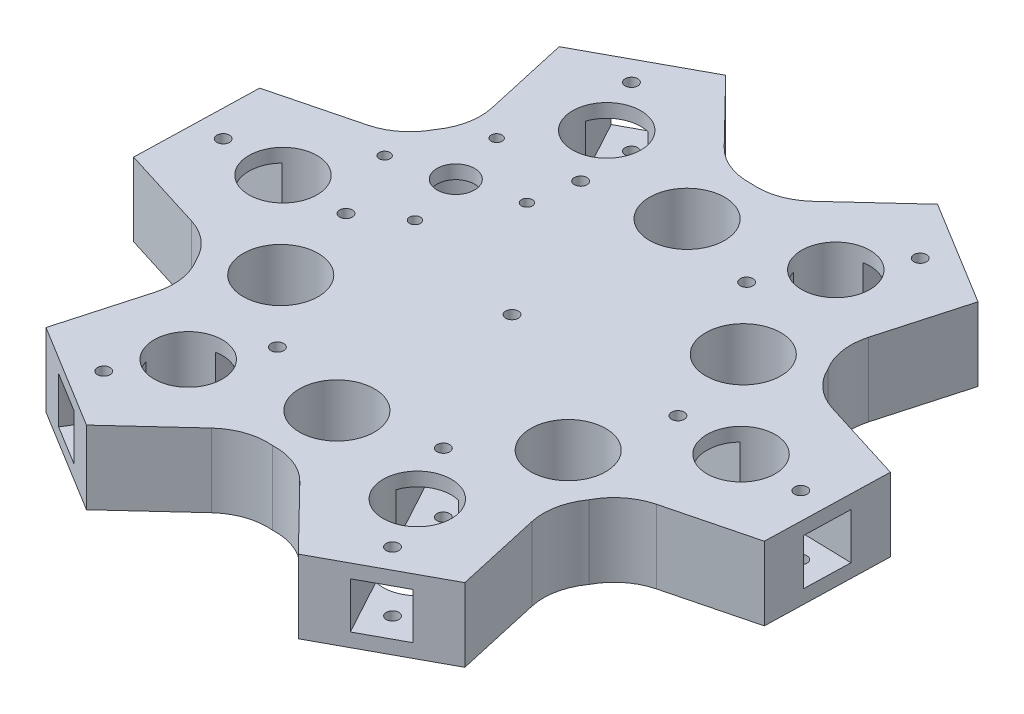
from build123d import *

# Parameters (mm, degrees)
CROQUIS2_R              = 1.85
CROQUIS2_R_2            = 10
CROQUIS2_R_3            = 11
SALIENTE_EXTRUIR1_DEPTH = 21.5
CROQUIS3_W              = 13.5
CROQUIS3_H              = 13.5
CORTAR_EXTRUIR1_DEPTH   = 227.063412752
MATRIZC1_COUNT          = 6
SALIENTE_EXTRUIR2_START = -4
CROQUIS4_R              = 11
CROQUIS4_R_2            = 5.5
SALIENTE_EXTRUIR2_DEPTH = 4
CORTAR_EXTRUIR2_START   = -10
CROQUIS5_R              = 1.6
CROQUIS5_R_2            = 5.5
CORTAR_EXTRUIR2_DEPTH   = 10


with BuildPart() as part:
    # Croquis2 → Saliente-Extruir1 (new body)
    with BuildSketch(Plane(origin=(0, 0, 0), x_dir=(1, 0, 0), z_dir=(0, 1, 0))):
        with BuildLine():
            Line((34.338474425, 90.387328615), (65.023396068, 71.560868943))
            Line((65.023396068, 71.560868943), (57.99870039, 46.557847845))
            ThreePointArc((57.99870039, 46.557847845), (57.540985683, 39.344606317), (60.071411753, 32.574281363))
            ThreePointArc((60.071411753, 32.574281363), (64.365061572, 26.760080874), (70.66006642, 23.20856429))
            Line((70.66006642, 23.20856429), (95.446959973, 15.455673128))
            Line((95.446959973, 15.455673128), (94.485228455, -20.531478364))
            Line((94.485228455, -20.531478364), (69.319629174, -26.949424002))
            ThreePointArc((69.319629174, -26.949424002), (62.843921414, -30.159652201), (58.245861047, -35.736227938))
            ThreePointArc((58.245861047, -35.736227938), (55.357440631, -42.361738001), (55.42923947, -49.589130408))
            Line((55.42923947, -49.589130408), (61.108485548, -74.931655487))
            Line((61.108485548, -74.931655487), (29.461832387, -92.092347306))
            Line((29.461832387, -92.092347306), (11.320928784, -73.507271847))
            ThreePointArc((11.320928784, -73.507271847), (5.302935731, -69.504258519), (-1.825550706, -68.310509301))
            ThreePointArc((-1.825550706, -68.310509301), (-9.007620942, -69.121818875), (-15.23082695, -72.797694698))
            Line((-15.23082695, -72.797694698), (-34.338474425, -90.387328615))
            Line((-34.338474425, -90.387328615), (-65.023396068, -71.560868943))
            Line((-65.023396068, -71.560868943), (-57.99870039, -46.557847845))
            ThreePointArc((-57.99870039, -46.557847845), (-57.540985683, -39.344606317), (-60.071411753, -32.574281363))
            ThreePointArc((-60.071411753, -32.574281363), (-64.365061572, -26.760080874), (-70.66006642, -23.20856429))
            Line((-70.66006642, -23.20856429), (-95.446959973, -15.455673128))
            Line((-95.446959973, -15.455673128), (-94.485228455, 20.531478364))
            Line((-94.485228455, 20.531478364), (-69.319629174, 26.949424002))
            ThreePointArc((-69.319629174, 26.949424002), (-62.843921414, 30.159652201), (-58.245861047, 35.736227938))
            ThreePointArc((-58.245861047, 35.736227938), (-55.357440631, 42.361738001), (-55.42923947, 49.589130408))
            Line((-55.42923947, 49.589130408), (-61.108485548, 74.931655487))
            Line((-61.108485548, 74.931655487), (-29.461832387, 92.092347306))
            Line((-29.461832387, 92.092347306), (-11.320928784, 73.507271847))
            ThreePointArc((-11.320928784, 73.507271847), (-5.302935731, 69.504258519), (1.825550706, 68.310509301))
            ThreePointArc((1.825550706, 68.310509301), (9.007620942, 69.121818875), (15.23082695, 72.797694698))
            Line((15.23082695, 72.797694698), (34.338474425, 90.387328615))
        make_face()
        with Locations((45.497277541, 74.155227303)):
            Circle(CROQUIS2_R, mode=Mode.SUBTRACT)
        with Locations((26.147860656, 42.617946726)):
            Circle(CROQUIS2_R, mode=Mode.SUBTRACT)
        with Locations((36.084047705, 58.812766481)):
            Circle(CROQUIS2_R_2, mode=Mode.SUBTRACT)
        Circle(CROQUIS2_R, mode=Mode.SUBTRACT)
        with Locations((43.953684946, 23.834294194)):
            Circle(CROQUIS2_R_3, mode=Mode.SUBTRACT)
        with Locations((68.975373692, -1.843318743)):
            Circle(CROQUIS2_R_2, mode=Mode.SUBTRACT)
        with Locations((86.968949438, -2.324184502)):
            Circle(CROQUIS2_R, mode=Mode.SUBTRACT)
        with Locations((49.98215485, -1.33573822)):
            Circle(CROQUIS2_R, mode=Mode.SUBTRACT)
        with Locations((42.617946726, -26.147860656)):
            Circle(CROQUIS2_R_3, mode=Mode.SUBTRACT)
        with Locations((32.891325987, -60.656085225)):
            Circle(CROQUIS2_R_2, mode=Mode.SUBTRACT)
        with Locations((41.471671897, -76.479411805)):
            Circle(CROQUIS2_R, mode=Mode.SUBTRACT)
        with Locations((23.834294194, -43.953684946)):
            Circle(CROQUIS2_R, mode=Mode.SUBTRACT)
        with Locations((-1.33573822, -49.98215485)):
            Circle(CROQUIS2_R_3, mode=Mode.SUBTRACT)
        with Locations((-36.084047705, -58.812766481)):
            Circle(CROQUIS2_R_2, mode=Mode.SUBTRACT)
        with Locations((-45.497277541, -74.155227303)):
            Circle(CROQUIS2_R, mode=Mode.SUBTRACT)
        with Locations((-26.147860656, -42.617946726)):
            Circle(CROQUIS2_R, mode=Mode.SUBTRACT)
        with Locations((-43.953684946, -23.834294194)):
            Circle(CROQUIS2_R_3, mode=Mode.SUBTRACT)
        with Locations((-68.975373692, 1.843318743)):
            Circle(CROQUIS2_R_2, mode=Mode.SUBTRACT)
        with Locations((-86.968949438, 2.324184502)):
            Circle(CROQUIS2_R, mode=Mode.SUBTRACT)
        with Locations((-49.98215485, 1.33573822)):
            Circle(CROQUIS2_R, mode=Mode.SUBTRACT)
        with Locations((-42.617946726, 26.147860656)):
            Circle(CROQUIS2_R_3, mode=Mode.SUBTRACT)
        with Locations((-32.891325987, 60.656085225)):
            Circle(CROQUIS2_R_2, mode=Mode.SUBTRACT)
        with Locations((-41.471671897, 76.479411805)):
            Circle(CROQUIS2_R, mode=Mode.SUBTRACT)
        with Locations((-23.834294194, 43.953684946)):
            Circle(CROQUIS2_R, mode=Mode.SUBTRACT)
        with Locations((1.33573822, 49.98215485)):
            Circle(CROQUIS2_R_3, mode=Mode.SUBTRACT)
    extrude(amount=SALIENTE_EXTRUIR1_DEPTH)

    # Croquis3 → Cortar-Extruir1 (cut, through all)
    with BuildSketch(Plane(origin=(45.285158968, 0, 83.512001397), x_dir=(0.8790736989108549, 0, -0.4766858838723754), z_dir=(0.4766858838723755, 0, 0.879073698910855))):
        with Locations((0, 10.75)):
            Rectangle(CROQUIS3_W, CROQUIS3_H)
    cortar_extruir1 = extrude(amount=-CORTAR_EXTRUIR1_DEPTH, mode=Mode.SUBTRACT)

    # MatrizC1: Cortar-Extruir1 ×6 about axis
    matrizc1_axis = Axis((0, 4, 0), (0, -1, 0))
    for i in range(1, MATRIZC1_COUNT):
        add(cortar_extruir1.rotate(matrizc1_axis, i * 360 / MATRIZC1_COUNT), mode=Mode.SUBTRACT)

    # Croquis4 → Saliente-Extruir2 (add)
    with BuildSketch(Plane(origin=(0, 21.5, 0), x_dir=(1, 0, 0), z_dir=(0, 1, 0)).offset(SALIENTE_EXTRUIR2_START)):
        with Locations((-42.617946726, 26.147860656)):
            Circle(CROQUIS4_R)
        with Locations((-42.617946726, 26.147860656)):
            Circle(CROQUIS4_R_2, mode=Mode.SUBTRACT)
    extrude(amount=SALIENTE_EXTRUIR2_DEPTH)

    # Croquis5 → Cortar-Extruir2 (cut)
    with BuildSketch(Plane(origin=(0, 21.5, 0), x_dir=(1, 0, 0), z_dir=(0, 1, 0)).offset(CORTAR_EXTRUIR2_START)):
        with Locations((-47.056631996, 42.558164525)):
            Circle(CROQUIS5_R)
        with Locations((-42.617946726, 26.147860656)):
            Circle(CROQUIS5_R_2)
        with Locations((-26.207642857, 30.586545927)):
            Circle(CROQUIS5_R)
        with Locations((-38.179261455, 9.737556787)):
            Circle(CROQUIS5_R)
        with Locations((-59.028250595, 21.709175385)):
            Circle(CROQUIS5_R)
    extrude(amount=CORTAR_EXTRUIR2_DEPTH, mode=Mode.SUBTRACT)


solid = part.part
